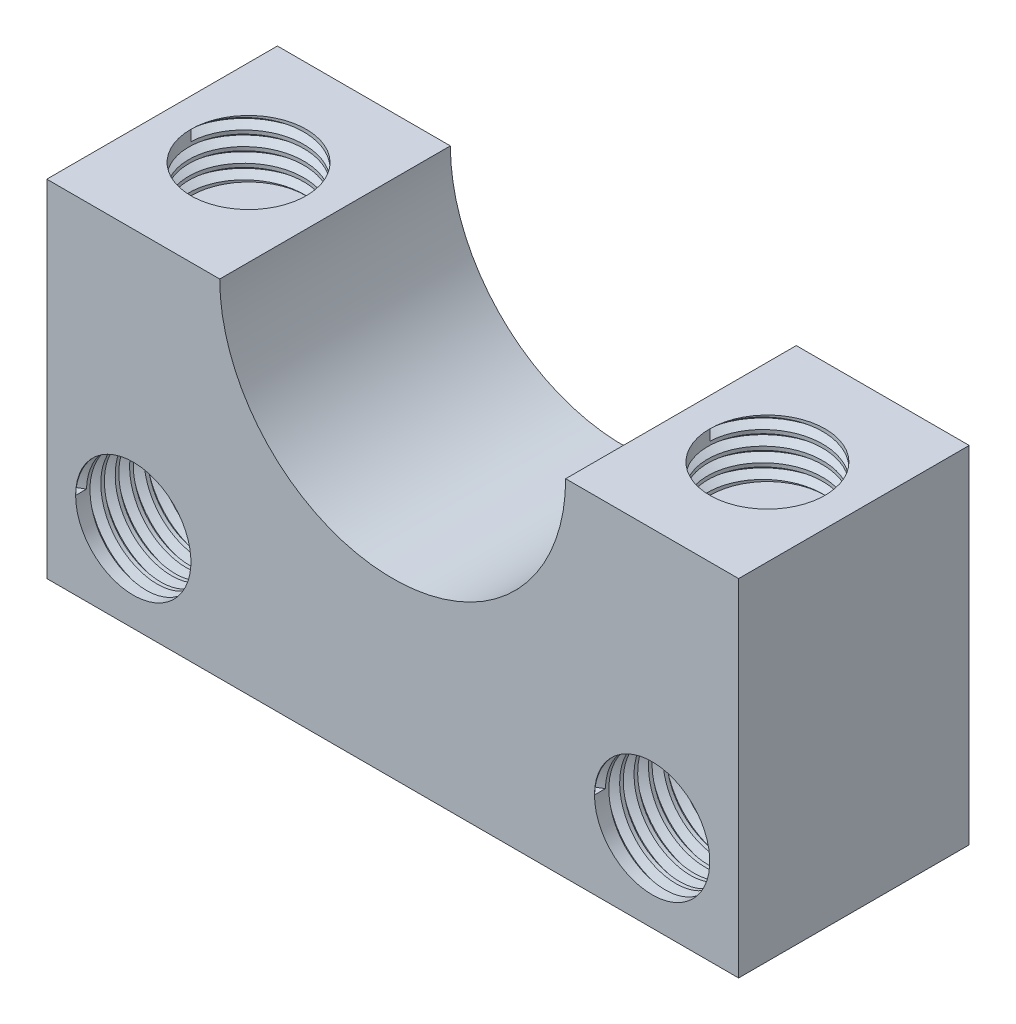
from build123d import *
from build123d.topology import SkipClean

# Parameters (mm, degrees)
SKETCH1_W           = 12
SKETCH1_H           = 6
BOSS_EXTRUDE1_DEPTH = 4
CUT_EXTRUDE1_DEPTH  = 4
CUT_EXTRUDE3_START  = 2
SKETCH4_R           = 1
CUT_EXTRUDE3_DEPTH  = 1
THREAD1_PITCH       = 0.25
THREAD2_PITCH       = 0.25
SKETCH3_R           = 1
CUT_EXTRUDE5_DEPTH  = 4
THREAD3_PITCH       = 0.25
THREAD4_PITCH       = 0.25


with BuildPart() as part:
    # Sketch1 → Boss-Extrude1 (new body)
    with BuildSketch(Plane.XY):
        Rectangle(SKETCH1_W, SKETCH1_H)
    extrude(amount=-BOSS_EXTRUDE1_DEPTH)

    # Sketch2 → Cut-Extrude1 (cut)
    with BuildSketch(Plane.XY):
        with BuildLine():
            Line((-3, 3), (3, 3))
            ThreePointArc((3, 3), (0, 0), (-3, 3))
        make_face()
    extrude(amount=-CUT_EXTRUDE1_DEPTH, mode=Mode.SUBTRACT)

    # Sketch4 → Cut-Extrude3 (cut)
    with BuildSketch(Plane(origin=(0, 0, 0), x_dir=(1, 0, 0), z_dir=(0, 1, 0)).offset(CUT_EXTRUDE3_START)):
        with Locations(Location((-4.5, 2, 0), (0, 0, 270))):
            Circle(SKETCH4_R)
        with Locations(Location((4.5, 2, 0), (0, 0, 270))):
            Circle(SKETCH4_R)
    extrude(amount=CUT_EXTRUDE3_DEPTH, mode=Mode.SUBTRACT)

    # Thread1: the profile of Thread Profile1 profile screwed along a right-hand helix of 4 turns, 6 arcs to a turn; built about Z, then put on its axis
    thread1_z = Axis((0, 0, 0), (0, 0, 1))
    thread1_corners = [(0.9997, 0, -0.000173205), (1.135316469, 0, 0.078125), (1.135316469, 0, 0.109375), (0.9997, 0, 0.187673204)]
    with BuildLine(mode=Mode.PRIVATE) as thread1_profile:
        Line(thread1_corners[0], thread1_corners[1])
        Line(thread1_corners[1], thread1_corners[2])
        Line(thread1_corners[2], thread1_corners[3])
        Line(thread1_corners[3], thread1_corners[0])
    thread1_cap = Face(thread1_profile.wire())
    thread1_turn_angles = [0, 30, 60, 90, 120, 150, 180, 210, 240, 270, 300, 330, 360]
    thread1_turn_weights = [1, 0.8660254037844387, 1, 0.8660254037844387, 1, 0.8660254037844387, 1, 0.8660254037844387, 1, 0.8660254037844387, 1, 0.8660254037844387, 1]
    thread1_turn_rails = [Edge.make_bspline([Vector(p[0], p[1], 0).rotate(thread1_z, thread1_turn_angles[k]) / thread1_turn_weights[k] + Vector(0, 0, p[2] + THREAD1_PITCH * thread1_turn_angles[k] / 360) for k in range(13)], [0, 0, 0, 1, 1, 2, 2, 3, 3, 4, 4, 5, 5, 6, 6, 6], 2, thread1_turn_weights) for p in thread1_corners]
    thread1_turn_sides = [Face.make_surface_from_curves(thread1_turn_rails[p[0]], thread1_turn_rails[p[1]]) for p in [(0, 1), (1, 2), (2, 3), (3, 0)]]
    thread1 = Plane(origin=(4.5, 3, -2), x_dir=(-1, 0, 0), z_dir=(0, -1, 0)) * Solid(Shell([*[p.moved(Location((0, 0, THREAD1_PITCH * i))) for i in range(4) for p in thread1_turn_sides], thread1_cap, thread1_cap.rotate(thread1_z, 1440).moved(Location((0, 0, THREAD1_PITCH * 1440 / 360)))]))
    add(thread1, mode=Mode.SUBTRACT)

    # Thread2: the profile of Thread Profile2 profile screwed along a right-hand helix of 4 turns, 6 arcs to a turn; built about Z, then put on its axis
    thread2_z = Axis((0, 0, 0), (0, 0, 1))
    thread2_corners = [(0.9997, 0, -0.000173205), (1.135316469, 0, 0.078125), (1.135316469, 0, 0.109375), (0.9997, 0, 0.187673204)]
    with BuildLine(mode=Mode.PRIVATE) as thread2_profile:
        Line(thread2_corners[0], thread2_corners[1])
        Line(thread2_corners[1], thread2_corners[2])
        Line(thread2_corners[2], thread2_corners[3])
        Line(thread2_corners[3], thread2_corners[0])
    thread2_cap = Face(thread2_profile.wire())
    thread2_turn_angles = [0, 30, 60, 90, 120, 150, 180, 210, 240, 270, 300, 330, 360]
    thread2_turn_weights = [1, 0.8660254037844387, 1, 0.8660254037844387, 1, 0.8660254037844387, 1, 0.8660254037844387, 1, 0.8660254037844387, 1, 0.8660254037844387, 1]
    thread2_turn_rails = [Edge.make_bspline([Vector(p[0], p[1], 0).rotate(thread2_z, thread2_turn_angles[k]) / thread2_turn_weights[k] + Vector(0, 0, p[2] + THREAD2_PITCH * thread2_turn_angles[k] / 360) for k in range(13)], [0, 0, 0, 1, 1, 2, 2, 3, 3, 4, 4, 5, 5, 6, 6, 6], 2, thread2_turn_weights) for p in thread2_corners]
    thread2_turn_sides = [Face.make_surface_from_curves(thread2_turn_rails[p[0]], thread2_turn_rails[p[1]]) for p in [(0, 1), (1, 2), (2, 3), (3, 0)]]
    thread2 = Plane(origin=(-4.5, 3, -2), x_dir=(-1, 0, 0), z_dir=(0, -1, 0)) * Solid(Shell([*[p.moved(Location((0, 0, THREAD2_PITCH * i))) for i in range(4) for p in thread2_turn_sides], thread2_cap, thread2_cap.rotate(thread2_z, 1440).moved(Location((0, 0, THREAD2_PITCH * 1440 / 360)))]))
    add(thread2, mode=Mode.SUBTRACT)

    # Sketch3 → Cut-Extrude5 (cut)
    with BuildSketch(Plane.XY):
        with Locations((4.5, -1.5)):
            Circle(SKETCH3_R)
        with Locations((-4.5, -1.5)):
            Circle(SKETCH3_R)
    extrude(amount=-CUT_EXTRUDE5_DEPTH, mode=Mode.SUBTRACT)

    # Thread3: the profile of Thread Profile5 profile screwed along a right-hand helix of 16 turns, 6 arcs to a turn; built about Z, then put on its axis
    with SkipClean():  # the faces are left unmerged after this step: merging them gives an invalid solid
        thread3_z = Axis((0, 0, 0), (0, 0, 1))
        thread3_corners = [(0.9997, 0, -0.000173205), (1.135316469, 0, 0.078125), (1.135316469, 0, 0.109375), (0.9997, 0, 0.187673204)]
        with BuildLine(mode=Mode.PRIVATE) as thread3_profile:
            Line(thread3_corners[0], thread3_corners[1])
            Line(thread3_corners[1], thread3_corners[2])
            Line(thread3_corners[2], thread3_corners[3])
            Line(thread3_corners[3], thread3_corners[0])
        thread3_cap = Face(thread3_profile.wire())
        thread3_turn_angles = [0, 30, 60, 90, 120, 150, 180, 210, 240, 270, 300, 330, 360]
        thread3_turn_weights = [1, 0.8660254037844387, 1, 0.8660254037844387, 1, 0.8660254037844387, 1, 0.8660254037844387, 1, 0.8660254037844387, 1, 0.8660254037844387, 1]
        thread3_turn_rails = [Edge.make_bspline([Vector(p[0], p[1], 0).rotate(thread3_z, thread3_turn_angles[k]) / thread3_turn_weights[k] + Vector(0, 0, p[2] + THREAD3_PITCH * thread3_turn_angles[k] / 360) for k in range(13)], [0, 0, 0, 1, 1, 2, 2, 3, 3, 4, 4, 5, 5, 6, 6, 6], 2, thread3_turn_weights) for p in thread3_corners]
        thread3_turn_sides = [Face.make_surface_from_curves(thread3_turn_rails[p[0]], thread3_turn_rails[p[1]]) for p in [(0, 1), (1, 2), (2, 3), (3, 0)]]
        thread3 = Plane(origin=(-4.5, -1.5, 0), x_dir=(-1, 0, 0), z_dir=(0, 0, -1)) * Solid(Shell([*[p.moved(Location((0, 0, THREAD3_PITCH * i))) for i in range(16) for p in thread3_turn_sides], thread3_cap, thread3_cap.rotate(thread3_z, 5760).moved(Location((0, 0, THREAD3_PITCH * 5760 / 360)))]))
        add(thread3, mode=Mode.SUBTRACT)

    # Thread4: the profile of Thread Profile6 profile screwed along a right-hand helix of 16 turns, 6 arcs to a turn; built about Z, then put on its axis
    with SkipClean():  # the faces are left unmerged after this step: merging them gives an invalid solid
        thread4_z = Axis((0, 0, 0), (0, 0, 1))
        thread4_corners = [(0.9997, 0, -0.000173205), (1.135316469, 0, 0.078125), (1.135316469, 0, 0.109375), (0.9997, 0, 0.187673204)]
        with BuildLine(mode=Mode.PRIVATE) as thread4_profile:
            Line(thread4_corners[0], thread4_corners[1])
            Line(thread4_corners[1], thread4_corners[2])
            Line(thread4_corners[2], thread4_corners[3])
            Line(thread4_corners[3], thread4_corners[0])
        thread4_cap = Face(thread4_profile.wire())
        thread4_turn_angles = [0, 30, 60, 90, 120, 150, 180, 210, 240, 270, 300, 330, 360]
        thread4_turn_weights = [1, 0.8660254037844387, 1, 0.8660254037844387, 1, 0.8660254037844387, 1, 0.8660254037844387, 1, 0.8660254037844387, 1, 0.8660254037844387, 1]
        thread4_turn_rails = [Edge.make_bspline([Vector(p[0], p[1], 0).rotate(thread4_z, thread4_turn_angles[k]) / thread4_turn_weights[k] + Vector(0, 0, p[2] + THREAD4_PITCH * thread4_turn_angles[k] / 360) for k in range(13)], [0, 0, 0, 1, 1, 2, 2, 3, 3, 4, 4, 5, 5, 6, 6, 6], 2, thread4_turn_weights) for p in thread4_corners]
        thread4_turn_sides = [Face.make_surface_from_curves(thread4_turn_rails[p[0]], thread4_turn_rails[p[1]]) for p in [(0, 1), (1, 2), (2, 3), (3, 0)]]
        thread4 = Plane(origin=(4.5, -1.5, 0), x_dir=(-1, 0, 0), z_dir=(0, 0, -1)) * Solid(Shell([*[p.moved(Location((0, 0, THREAD4_PITCH * i))) for i in range(16) for p in thread4_turn_sides], thread4_cap, thread4_cap.rotate(thread4_z, 5760).moved(Location((0, 0, THREAD4_PITCH * 5760 / 360)))]))
        add(thread4, mode=Mode.SUBTRACT)


solid = part.part
